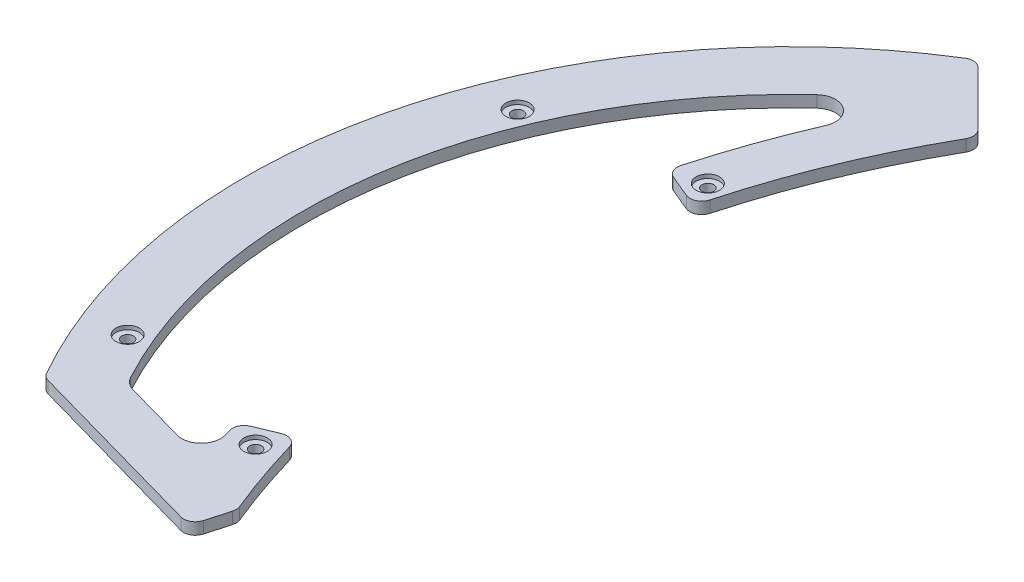
from build123d import *

# Parameters (mm, degrees)
SKETCH1_R               = 140
BOSS_EXTRUDE1_DEPTH     = 3
CUT_EXTRUDE1_REACH      = 200.013
CUT_EXTRUDE3_REACH      = 200.013
SKETCH19_R              = 1.5
CUT_EXTRUDE10_REACH     = 200.013
SKETCH25_R              = 1.5
CUT_EXTRUDE4_REACH      = 200.013
FILLET2_R               = 10
CUT_EXTRUDE8_DEPTH      = 185.458667457
CUT_EXTRUDE8_DEPTH_BACK = 185.458667457
CUT_EXTRUDE9_REACH      = 186.459
FILLET4_R               = 5
FILLET5_R               = 3
SKETCH26_R              = 3
CUT_EXTRUDE11_DEPTH     = 1


with BuildPart() as part:
    # Sketch1 → Boss-Extrude1 (new body)
    with BuildSketch(Plane(origin=(0, 0, 0), x_dir=(1, 0, 0), z_dir=(0, 1, 0))):
        Circle(SKETCH1_R)
    extrude(amount=BOSS_EXTRUDE1_DEPTH)

    # Sketch17 → Cut-Extrude1 (cut, up to next)
    with BuildSketch(Plane.XZ, mode=Mode.PRIVATE) as cut_extrude1_sk1:
        Polygon((-50, 90), (-121.24355653, 70), (-121.24355653, 140), (121.24355653, 140), (121.24355653, 70), (50, 90), align=None)
    cut_extrude1_tool1 = extrude(cut_extrude1_sk1.sketch, amount=-CUT_EXTRUDE1_REACH, mode=Mode.PRIVATE) & part.part
    add(cut_extrude1_tool1.solids().sort_by_distance((0, 0, 111.669853))[0], mode=Mode.SUBTRACT)

    # Sketch19 → Cut-Extrude3 (cut, up to next)
    with BuildSketch(Plane(origin=(0, 3, 0), x_dir=(1, 0, 0), z_dir=(0, 1, 0)), mode=Mode.PRIVATE) as cut_extrude3_sk1:
        with Locations((-79.195959493, -57.982756057)):
            Circle(SKETCH19_R)
    cut_extrude3_tool1 = extrude(cut_extrude3_sk1.sketch, amount=-CUT_EXTRUDE3_REACH, mode=Mode.PRIVATE) & part.part
    # Sketch19 → Cut-Extrude3 (cut, up to next)
    with BuildSketch(Plane(origin=(0, 3, 0), x_dir=(1, 0, 0), z_dir=(0, 1, 0)), mode=Mode.PRIVATE) as cut_extrude3_sk2:
        with Locations((-79.195959493, 57.982756057)):
            Circle(SKETCH19_R)
    cut_extrude3_tool2 = extrude(cut_extrude3_sk2.sketch, amount=-CUT_EXTRUDE3_REACH, mode=Mode.PRIVATE) & part.part
    # Sketch19 → Cut-Extrude3 (cut, up to next)
    with BuildSketch(Plane(origin=(0, 3, 0), x_dir=(1, 0, 0), z_dir=(0, 1, 0)), mode=Mode.PRIVATE) as cut_extrude3_sk3:
        with Locations((79.195959493, 57.982756057)):
            Circle(SKETCH19_R)
    cut_extrude3_tool3 = extrude(cut_extrude3_sk3.sketch, amount=-CUT_EXTRUDE3_REACH, mode=Mode.PRIVATE) & part.part
    # Sketch19 → Cut-Extrude3 (cut, up to next)
    with BuildSketch(Plane(origin=(0, 3, 0), x_dir=(1, 0, 0), z_dir=(0, 1, 0)), mode=Mode.PRIVATE) as cut_extrude3_sk4:
        with Locations((79.195959493, -57.982756057)):
            Circle(SKETCH19_R)
    cut_extrude3_tool4 = extrude(cut_extrude3_sk4.sketch, amount=-CUT_EXTRUDE3_REACH, mode=Mode.PRIVATE) & part.part
    # Sketch19 → Cut-Extrude3 (cut, up to next)
    with BuildSketch(Plane(origin=(0, 3, 0), x_dir=(1, 0, 0), z_dir=(0, 1, 0)), mode=Mode.PRIVATE) as cut_extrude3_sk5:
        with Locations((-57.982756057, 79.195959493)):
            Circle(SKETCH19_R)
    cut_extrude3_tool5 = extrude(cut_extrude3_sk5.sketch, amount=-CUT_EXTRUDE3_REACH, mode=Mode.PRIVATE) & part.part
    # Sketch19 → Cut-Extrude3 (cut, up to next)
    with BuildSketch(Plane(origin=(0, 3, 0), x_dir=(1, 0, 0), z_dir=(0, 1, 0)), mode=Mode.PRIVATE) as cut_extrude3_sk6:
        with Locations((57.982756057, 79.195959493)):
            Circle(SKETCH19_R)
    cut_extrude3_tool6 = extrude(cut_extrude3_sk6.sketch, amount=-CUT_EXTRUDE3_REACH, mode=Mode.PRIVATE) & part.part
    # Sketch19 → Cut-Extrude3 (cut, up to next)
    with BuildSketch(Plane(origin=(0, 3, 0), x_dir=(1, 0, 0), z_dir=(0, 1, 0)), mode=Mode.PRIVATE) as cut_extrude3_sk7:
        with Locations((57.982756057, -79.195959493)):
            Circle(SKETCH19_R)
    cut_extrude3_tool7 = extrude(cut_extrude3_sk7.sketch, amount=-CUT_EXTRUDE3_REACH, mode=Mode.PRIVATE) & part.part
    # Sketch19 → Cut-Extrude3 (cut, up to next)
    with BuildSketch(Plane(origin=(0, 3, 0), x_dir=(1, 0, 0), z_dir=(0, 1, 0)), mode=Mode.PRIVATE) as cut_extrude3_sk8:
        with Locations((-57.982756057, -79.195959493)):
            Circle(SKETCH19_R)
    cut_extrude3_tool8 = extrude(cut_extrude3_sk8.sketch, amount=-CUT_EXTRUDE3_REACH, mode=Mode.PRIVATE) & part.part
    add(cut_extrude3_tool1.solids().sort_by_distance((-79.195959, 3, 57.982756))[0], mode=Mode.SUBTRACT)
    add(cut_extrude3_tool2.solids().sort_by_distance((-79.195959, 3, -57.982756))[0], mode=Mode.SUBTRACT)
    add(cut_extrude3_tool3.solids().sort_by_distance((79.195959, 3, -57.982756))[0], mode=Mode.SUBTRACT)
    add(cut_extrude3_tool4.solids().sort_by_distance((79.195959, 3, 57.982756))[0], mode=Mode.SUBTRACT)
    add(cut_extrude3_tool5.solids().sort_by_distance((-57.982756, 3, -79.195959))[0], mode=Mode.SUBTRACT)
    add(cut_extrude3_tool6.solids().sort_by_distance((57.982756, 3, -79.195959))[0], mode=Mode.SUBTRACT)
    add(cut_extrude3_tool7.solids().sort_by_distance((57.982756, 3, 79.195959))[0], mode=Mode.SUBTRACT)
    add(cut_extrude3_tool8.solids().sort_by_distance((-57.982756, 3, 79.195959))[0], mode=Mode.SUBTRACT)

    # Sketch25 → Cut-Extrude10 (cut, up to next)
    with BuildSketch(Plane(origin=(0, 3, 0), x_dir=(1, 0, 0), z_dir=(0, 1, 0)), mode=Mode.PRIVATE) as cut_extrude10_sk1:
        with Locations((-120, 50)):
            Circle(SKETCH25_R)
    cut_extrude10_tool1 = extrude(cut_extrude10_sk1.sketch, amount=-CUT_EXTRUDE10_REACH, mode=Mode.PRIVATE) & part.part
    # Sketch25 → Cut-Extrude10 (cut, up to next)
    with BuildSketch(Plane(origin=(0, 3, 0), x_dir=(1, 0, 0), z_dir=(0, 1, 0)), mode=Mode.PRIVATE) as cut_extrude10_sk2:
        with Locations((-120, -50)):
            Circle(SKETCH25_R)
    cut_extrude10_tool2 = extrude(cut_extrude10_sk2.sketch, amount=-CUT_EXTRUDE10_REACH, mode=Mode.PRIVATE) & part.part
    add(cut_extrude10_tool1.solids().sort_by_distance((-120, 3, -50))[0], mode=Mode.SUBTRACT)
    add(cut_extrude10_tool2.solids().sort_by_distance((-120, 3, 50))[0], mode=Mode.SUBTRACT)

    # Sketch20 → Cut-Extrude4 (cut, up to next)
    with BuildSketch(Plane(origin=(0, 3, 0), x_dir=(1, 0, 0), z_dir=(0, 1, 0)), mode=Mode.PRIVATE) as cut_extrude4_sk1:
        Polygon((-501.142143979, 549.208792138), (-72, 120.066648158), (-50, 98.066648158), (50, 98.066648158), (72, 120.066648158), (501.142143979, 549.208792138), (501.142143979, 1763.00607254), (-501.142143979, 1763.00607254), align=None)
    cut_extrude4_tool1 = extrude(cut_extrude4_sk1.sketch, amount=-CUT_EXTRUDE4_REACH, mode=Mode.PRIVATE) & part.part
    add(cut_extrude4_tool1.solids().sort_by_distance((0, 3, -1025.283687))[0], mode=Mode.SUBTRACT)

    # Fillet2
    fillet2_edges = [part.edges().sort_by_distance(p)[0] for p in [
        (50, 1.5, -98.066648158),
        (-50, 1.5, -98.066648158),
    ]]
    fillet(fillet2_edges, radius=FILLET2_R)

    # Sketch23 → Cut-Extrude8 (cut, two sides: drawn at the far end of the back side and taken through both)
    with BuildSketch(Plane(origin=(0, 3, 0), x_dir=(1, 0, 0), z_dir=(0, 1, 0)).offset(-CUT_EXTRUDE8_DEPTH_BACK)):
        with BuildLine():
            Line((257.25555619, 635.882543767), (-54.933351842, 103))
            ThreePointArc((-54.933351842, 103), (-81.898962794, 15.574433529), (-67.110613718, -74.712213204))
            Line((-67.110613718, -74.712213204), (-73.189737717, -96.367133919))
            Line((-73.189737717, -96.367133919), (-240.113193325, -690.978166206))
            Line((-240.113193325, -690.978166206), (916.492938423, -1124.527627053))
            Line((916.492938423, -1124.527627053), (1413.861687938, 202.33308292))
            Line((1413.861687938, 202.33308292), (257.25555619, 635.882543767))
        make_face()
    extrude(amount=CUT_EXTRUDE8_DEPTH + CUT_EXTRUDE8_DEPTH_BACK, mode=Mode.SUBTRACT)

    # Sketch24 → Cut-Extrude9 (cut, up to next)
    with BuildSketch(Plane(origin=(0, 3, 0), x_dir=(1, 0, 0), z_dir=(0, 1, 0)), mode=Mode.PRIVATE) as cut_extrude9_sk1:
        with BuildLine():
            Line((-87.357146899, 55.966584143), (-76.169199175, 51.304939258))
            Line((-76.169199175, 51.304939258), (-75.263305358, -50.927483501))
            Line((-75.263305358, -50.927483501), (-86.425648637, -55.578459868))
            ThreePointArc((-86.425648637, -55.578459868), (-84.491324796, -62.048707618), (-82.351900579, -68.454063088))
            Line((-82.351900579, -68.454063088), (-109.142815319, -60.933126165))
            ThreePointArc((-109.142815319, -60.933126165), (-121.247849947, 30.39669198), (-67.489752352, 105.2147011))
            ThreePointArc((-67.489752352, 105.2147011), (-78.971583679, 81.215182034), (-87.357146899, 55.966584143))
        make_face()
    cut_extrude9_tool1 = extrude(cut_extrude9_sk1.sketch, amount=-CUT_EXTRUDE9_REACH, mode=Mode.PRIVATE) & part.part
    add(cut_extrude9_tool1.solids().sort_by_distance((-97.439624, 3, -6.929648))[0], mode=Mode.SUBTRACT)

    # Fillet4
    fillet4_edges = [part.edges().sort_by_distance(p)[0] for p in [
        (-82.351900579, 1.5, 68.454063088),
        (-109.142815319, 1.5, 60.933126165),
        (-67.489752352, 1.5, -105.2147011),
    ]]
    fillet(fillet4_edges, radius=FILLET4_R)

    # Fillet5
    fillet5_edges = [part.edges().sort_by_distance(p)[0] for p in [
        (-72, 1.5, -120.066648158),
        (-67.110613718, 1.5, 74.712213204),
        (-69.838855295, 1.5, 84.430694855),
        (-121.24355653, 1.5, 70),
        (-54.933351842, 1.5, -103),
        (-86.425648637, 1.5, 55.578459868),
        (-75.263305358, 1.5, 50.927483501),
        (-87.357146899, 1.5, -55.966584143),
        (-76.169199175, 1.5, -51.304939258),
    ]]
    fillet(fillet5_edges, radius=FILLET5_R)

    # Sketch26 → Cut-Extrude11 (cut)
    with BuildSketch(Plane.XZ.offset(-3)):
        with Locations((-79.195959493, 57.982756057)):
            Circle(SKETCH26_R)
        with Locations((-120, 50)):
            Circle(SKETCH26_R)
        with Locations((-120, -50)):
            Circle(SKETCH26_R)
        with Locations((-79.195959493, -57.982756057)):
            Circle(SKETCH26_R)
    extrude(amount=CUT_EXTRUDE11_DEPTH, mode=Mode.SUBTRACT)


solid = part.part
